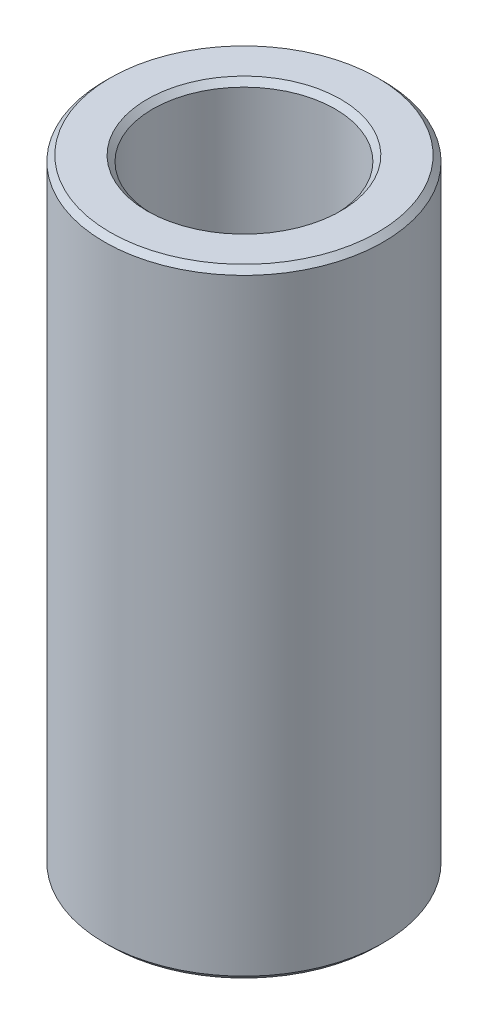
from build123d import *

# Parameters (mm, degrees)
SKETCH1_R           = 47.5
BOSS_EXTRUDE1_DEPTH = 210.644641933
SKETCH2_R           = 31.082066227
CUT_EXTRUDE1_DEPTH  = 222.096506474
CHAMFER1_SIZE       = 1.913571274


with BuildPart() as part:
    # Sketch1 → Boss-Extrude1 (new body)
    with BuildSketch(Plane(origin=(0, 0, 0), x_dir=(1, 0, 0), z_dir=(0, 1, 0))):
        Circle(SKETCH1_R)
    extrude(amount=BOSS_EXTRUDE1_DEPTH)

    # Sketch2 → Cut-Extrude1 (cut, through all)
    with BuildSketch(Plane(origin=(0, 0, 0), x_dir=(1, 0, 0), z_dir=(0, 1, 0))):
        Circle(SKETCH2_R)
    extrude(amount=CUT_EXTRUDE1_DEPTH, mode=Mode.SUBTRACT)

    # Chamfer1
    chamfer1_edges = [part.edges().sort_by_distance(p)[0] for p in [
        (-31.082066227, 210.644641933, 0),
        (-31.082066227, 0, 0),
        (-47.5, 0, 0),
        (-47.5, 210.644641933, 0),
    ]]
    chamfer(chamfer1_edges, length=CHAMFER1_SIZE)


solid = part.part
